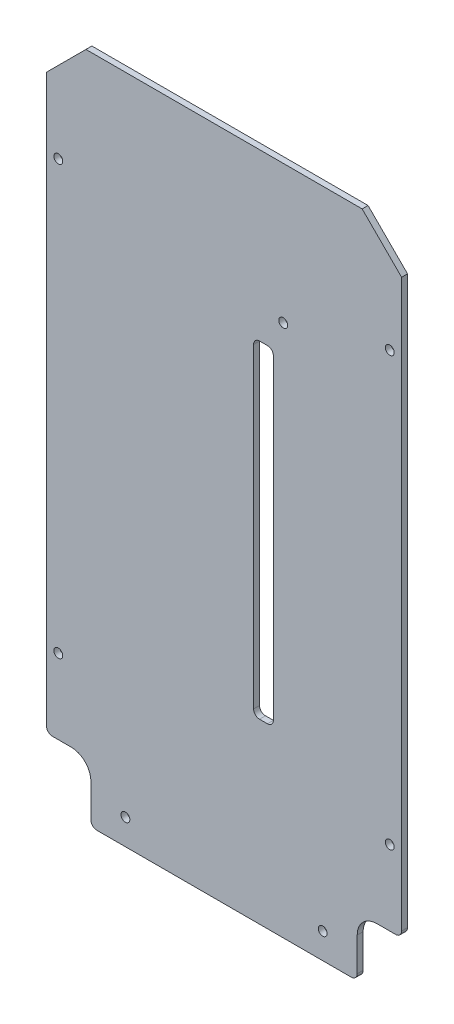
from build123d import *

# Parameters (mm, degrees)
ESQUISSE1_W                  = 180
ESQUISSE1_H                  = 340
BOSS_EXTRU_1_DEPTH           = 3
ENL_V_MAT_EXTRU_1_DEPTH      = 385.719378249
ENL_V_MAT_EXTRU_1_DEPTH_BACK = 385.719378249
ESQUISSE2_R                  = 2.25
ENL_V_MAT_EXTRU_2_DEPTH      = 385.719378249
ENL_V_MAT_EXTRU_2_DEPTH_BACK = 385.719378249
ESQUISSE3_W                  = 22.5
ESQUISSE3_H                  = 30
CONG_1_R                     = 10
CONG_2_R                     = 3
ENL_V_MAT_EXTRU_3_DEPTH      = 385.719378249
ENL_V_MAT_EXTRU_3_DEPTH_BACK = 385.719378249
ESQUISSE4_W                  = 10
ESQUISSE4_H                  = 166
CONG_3_R                     = 3
CHANFREIN1_SIZE              = 20
CHANFREIN2_SIZE              = 20
ESQUISSE5_R                  = 2.25
ENL_V_MAT_EXTRU_4_DEPTH      = 385.719378249
ENL_V_MAT_EXTRU_5_DEPTH      = 385.719378249
ENL_V_MAT_EXTRU_5_DEPTH_BACK = 385.719378249
ESQUISSE6_R                  = 2.25


with BuildPart() as part:
    # Esquisse1 → Boss.-Extru.1 (new body)
    with BuildSketch(Plane.XY):
        with Locations((90, 170)):
            Rectangle(ESQUISSE1_W, ESQUISSE1_H)
    extrude(amount=BOSS_EXTRU_1_DEPTH)

    # Esquisse2 → Enlèv. mat.-Extru.1 (cut, two sides: drawn at the far end of the back side and taken through both)
    with BuildSketch(Plane.XY.offset(3).offset(-ENL_V_MAT_EXTRU_1_DEPTH_BACK)):
        with Locations((40, 13)):
            Circle(ESQUISSE2_R)
        with Locations((140, 13)):
            Circle(ESQUISSE2_R)
    extrude(amount=ENL_V_MAT_EXTRU_1_DEPTH + ENL_V_MAT_EXTRU_1_DEPTH_BACK, mode=Mode.SUBTRACT)

    # Esquisse3 → Enlèv. mat.-Extru.2 (cut, two sides: drawn at the far end of the back side and taken through both)
    with BuildSketch(Plane.XY.offset(3).offset(-ENL_V_MAT_EXTRU_2_DEPTH_BACK)):
        with Locations((11.25, 15)):
            Rectangle(ESQUISSE3_W, ESQUISSE3_H)
        with Locations((168.75, 15)):
            Rectangle(ESQUISSE3_W, ESQUISSE3_H)
    extrude(amount=ENL_V_MAT_EXTRU_2_DEPTH + ENL_V_MAT_EXTRU_2_DEPTH_BACK, mode=Mode.SUBTRACT)

    # Congé1
    cong_1_edges = [part.edges().sort_by_distance(p)[0] for p in [
        (157.5, 30, 1.5),
        (22.5, 30, 1.5),
    ]]
    fillet(cong_1_edges, radius=CONG_1_R)

    # Congé2
    cong_2_edges = [part.edges().sort_by_distance(p)[0] for p in [
        (0, 30, 1.5),
        (22.5, 0, 1.5),
        (180, 30, 1.5),
        (157.5, 0, 1.5),
    ]]
    fillet(cong_2_edges, radius=CONG_2_R)

    # Esquisse4 → Enlèv. mat.-Extru.3 (cut, two sides: drawn at the far end of the back side and taken through both)
    with BuildSketch(Plane.XY.offset(3).offset(-ENL_V_MAT_EXTRU_3_DEPTH_BACK)):
        with Locations((110, 173)):
            Rectangle(ESQUISSE4_W, ESQUISSE4_H)
    extrude(amount=ENL_V_MAT_EXTRU_3_DEPTH + ENL_V_MAT_EXTRU_3_DEPTH_BACK, mode=Mode.SUBTRACT)

    # Congé3
    cong_3_edges = [part.edges().sort_by_distance(p)[0] for p in [
        (105, 256, 1.5),
        (115, 256, 1.5),
        (115, 90, 1.5),
        (105, 90, 1.5),
    ]]
    fillet(cong_3_edges, radius=CONG_3_R)

    # Chanfrein1
    chanfrein1_edges = [part.edges().sort_by_distance(p)[0] for p in [
        (180, 340, 1.5),
    ]]
    chamfer(chanfrein1_edges, length=CHANFREIN1_SIZE)

    # Chanfrein2
    chanfrein2_edges = [part.edges().sort_by_distance(p)[0] for p in [
        (0, 340, 1.5),
    ]]
    chamfer(chanfrein2_edges, length=CHANFREIN2_SIZE)

    # Esquisse5 → Enlèv. mat.-Extru.4 (cut, through all)
    with BuildSketch(Plane.XY.offset(3)):
        with Locations((120, 270)):
            Circle(ESQUISSE5_R)
    extrude(amount=-ENL_V_MAT_EXTRU_4_DEPTH, mode=Mode.SUBTRACT)

    # Esquisse6 → Enlèv. mat.-Extru.5 (cut, two sides: drawn at the far end of the back side and taken through both)
    with BuildSketch(Plane.XY.offset(3).offset(-ENL_V_MAT_EXTRU_5_DEPTH_BACK)):
        with Locations((6, 285)):
            Circle(ESQUISSE6_R)
        with Locations((6, 68)):
            Circle(ESQUISSE6_R)
        with Locations((174, 68)):
            Circle(ESQUISSE6_R)
        with Locations((174, 285)):
            Circle(ESQUISSE6_R)
    extrude(amount=ENL_V_MAT_EXTRU_5_DEPTH + ENL_V_MAT_EXTRU_5_DEPTH_BACK, mode=Mode.SUBTRACT)


solid = part.part
